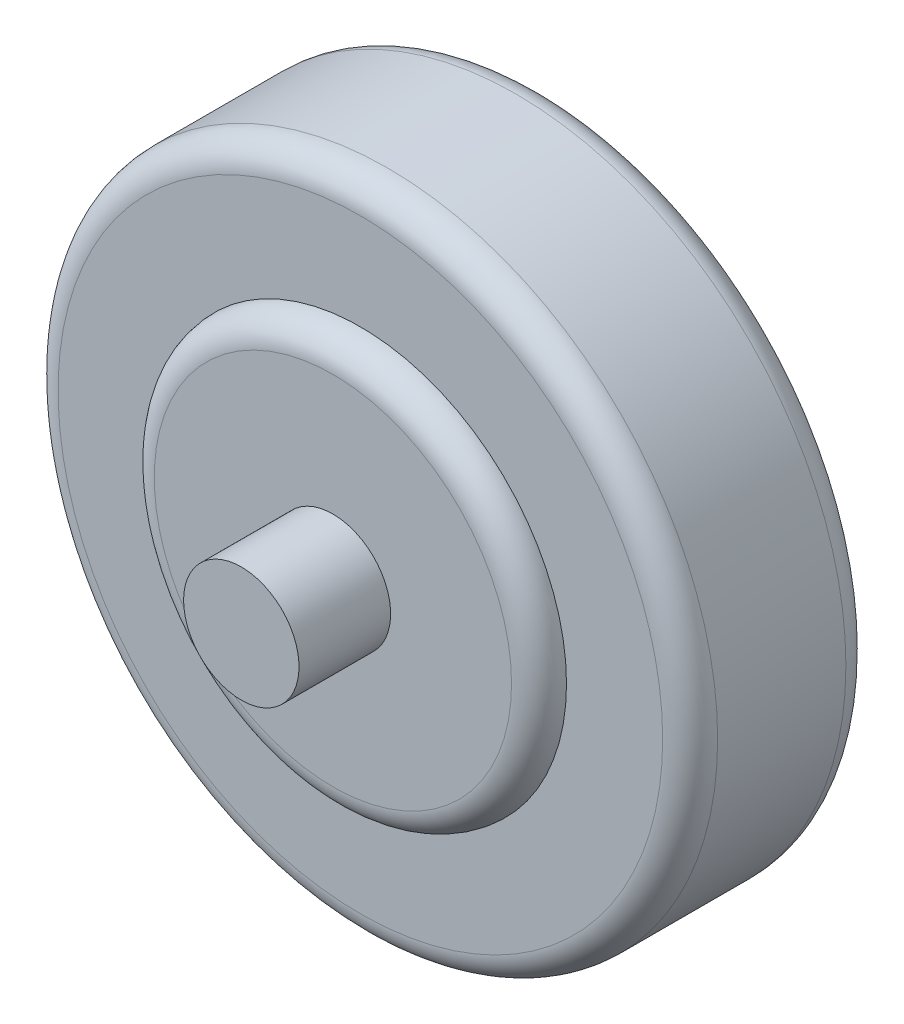
from build123d import *

# Parameters (mm, degrees)
SKETCH1_R           = 360
BOSS_EXTRUDE1_DEPTH = 200
SKETCH2_R           = 225
BOSS_EXTRUDE2_DEPTH = 30
SKETCH3_R           = 63
BOSS_EXTRUDE3_DEPTH = 100
FILLET1_R           = 30
SKETCH4_R           = 201.886899345
CUT_EXTRUDE1_DEPTH  = 40
FILLET2_R           = 30
FILLET3_R           = 30
SKETCH5_R           = 89.311171206
BOSS_EXTRUDE4_DEPTH = 30
FILLET4_R           = 30
FILLET5_R           = 30


with BuildPart() as part:
    # Sketch1 → Boss-Extrude1 (new body)
    with BuildSketch(Plane.XY):
        Circle(SKETCH1_R)
    extrude(amount=BOSS_EXTRUDE1_DEPTH)

    # Sketch2 → Boss-Extrude2 (add)
    with BuildSketch(Plane.XY.offset(200)):
        Circle(SKETCH2_R)
    extrude(amount=BOSS_EXTRUDE2_DEPTH)

    # Sketch3 → Boss-Extrude3 (add)
    with BuildSketch(Plane.XY.offset(230)):
        with Locations(Location((0, 0, 0), (0, 0, 180))):
            Circle(SKETCH3_R)
    extrude(amount=BOSS_EXTRUDE3_DEPTH)

    # Fillet1
    fillet1_edges = [part.edges().sort_by_distance(p)[0] for p in [
        (-360, 0, 0),
        (-360, 0, 200),
        (-225, 0, 230),
    ]]
    fillet(fillet1_edges, radius=FILLET1_R - 0.0001)  # a hair under: the kernel refuses the full size

    # Sketch4 → Cut-Extrude1 (cut)
    with BuildSketch(Plane(origin=(0, 0, 0), x_dir=(-1, 0, 0), z_dir=(0, 0, -1))):
        Circle(SKETCH4_R)
    extrude(amount=-CUT_EXTRUDE1_DEPTH, mode=Mode.SUBTRACT)

    # Fillet2
    fillet2_edges = [part.edges().sort_by_distance(p)[0] for p in [
        (201.886899345, 0, 0),
    ]]
    fillet(fillet2_edges, radius=FILLET2_R)

    # Fillet3
    fillet3_edges = [part.edges().sort_by_distance(p)[0] for p in [
        (201.886899345, 0, 40),
    ]]
    fillet(fillet3_edges, radius=FILLET3_R)

    # Sketch5 → Boss-Extrude4 (add)
    with BuildSketch(Plane(origin=(0, 0, 40), x_dir=(-1, 0, 0), z_dir=(0, 0, -1))):
        Circle(SKETCH5_R)
    extrude(amount=BOSS_EXTRUDE4_DEPTH)

    # Fillet4
    fillet4_edges = [part.edges().sort_by_distance(p)[0] for p in [
        (89.311171206, 0, 40),
    ]]
    fillet(fillet4_edges, radius=FILLET4_R - 0.0001)  # a hair under: the kernel refuses the full size

    # Fillet5
    fillet5_edges = [part.edges().sort_by_distance(p)[0] for p in [
        (89.311171206, 0, 10),
    ]]
    fillet(fillet5_edges, radius=FILLET5_R)


solid = part.part
